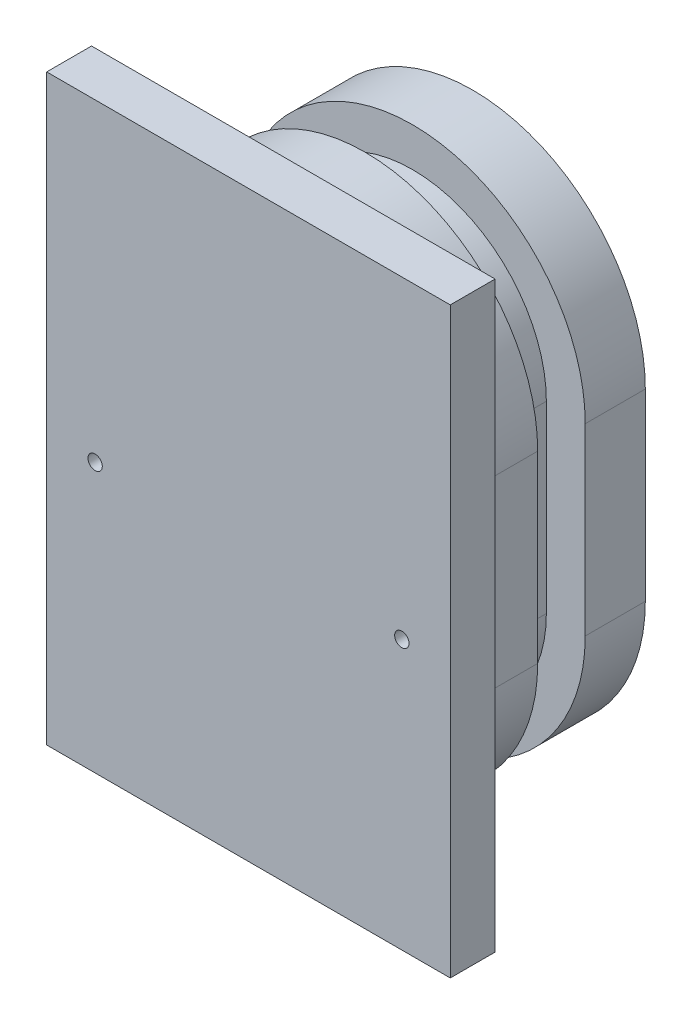
from build123d import *

# Parameters (mm, degrees)
SKETCH1_W                 = 45
SKETCH1_H                 = 65
BOSS_EXTRUDE1_DEPTH       = 5
BOSS_EXTRUDE2_DEPTH       = 20
BOSS_EXTRUDE3_DEPTH       = 5.3
M2X0_4_TAPPED_HOLE1_D     = 1.6
M2X0_4_TAPPED_HOLE1_DEPTH = 6
M2X0_4_TAPPED_HOLE1_TIP   = 0.480688495


with BuildPart() as part:
    # Sketch1 → Boss-Extrude1 (new body)
    with BuildSketch(Plane.XY):
        with Locations((2.886207951, -16.286739239)):
            Rectangle(SKETCH1_W, SKETCH1_H)
    extrude(amount=BOSS_EXTRUDE1_DEPTH)

    # Sketch4 → Boss-Extrude2 (add)
    with BuildSketch(Plane(origin=(0, 0, 0), x_dir=(-1, 0, 0), z_dir=(0, 0, -1))):
        with BuildLine():
            Line((16.363792049, -6.036739239), (16.363792049, -26.536739239))
            ThreePointArc((16.363792049, -26.536739239), (-2.886207951, -45.786739239), (-22.136207951, -26.536739239))
            Line((-22.136207951, -26.536739239), (-22.136207951, -6.036739239))
            ThreePointArc((-22.136207951, -6.036739239), (-2.886207951, 13.213260761), (16.363792049, -6.036739239))
        make_face()
        with BuildLine():
            Line((7.863792049, -6.036739239), (7.863792049, -26.536739239))
            ThreePointArc((7.863792049, -26.536739239), (-2.886207951, -37.286739239), (-13.636207951, -26.536739239))
            Line((-13.636207951, -26.536739239), (-13.636207951, -6.036739239))
            ThreePointArc((-13.636207951, -6.036739239), (-2.886207951, 4.713260761), (7.863792049, -6.036739239))
        make_face(mode=Mode.SUBTRACT)
    extrude(amount=BOSS_EXTRUDE2_DEPTH)


with BuildPart() as body_2:
    # Sketch6 → Boss-Extrude3 (new body)
    with BuildSketch(Plane(origin=(0, 0, 0), x_dir=(-1, 0, 0), z_dir=(0, 0, -1))):
        with BuildLine():
            Line((16.363792049, -6.036739239), (16.363792049, -26.536739239))
            ThreePointArc((16.363792049, -26.536739239), (-2.886207951, -45.786739239), (-22.136207951, -26.536739239))
            Line((-22.136207951, -26.536739239), (-22.136207951, -6.036739239))
            ThreePointArc((-22.136207951, -6.036739239), (-2.886207951, 13.213260761), (16.363792049, -6.036739239))
        make_face()
        with BuildLine():
            Line((12.029792049, -6.036739239), (12.029792049, -26.536739239))
            ThreePointArc((12.029792049, -26.536739239), (-2.886207951, -41.452739239), (-17.802207951, -26.536739239))
            Line((-17.802207951, -26.536739239), (-17.802207951, -6.036739239))
            ThreePointArc((-17.802207951, -6.036739239), (-2.886207951, 8.879260761), (12.029792049, -6.036739239))
        make_face(mode=Mode.SUBTRACT)
    extrude(amount=BOSS_EXTRUDE3_DEPTH)


with BuildPart() as body_2_1:
    # Body-Move/Copy1: read off the stored shape, not the designer's step
    # Body-Move/Copy1: moved
    add(body_2.part.moved(Location((0, 0, -8))))


with BuildPart() as part_1:
    add(part.part)

    # Combine1: cut body 2
    add(body_2_1.part, mode=Mode.SUBTRACT)

    # M2x0.4 Tapped Hole1
    with Locations(Plane.XY.offset(5)):
        with Locations((-14.213792049, -18.786739239), (19.986207951, -18.786739239)):
            Hole(M2X0_4_TAPPED_HOLE1_D / 2, depth=M2X0_4_TAPPED_HOLE1_DEPTH)
            with Locations((0, 0, -(M2X0_4_TAPPED_HOLE1_DEPTH + M2X0_4_TAPPED_HOLE1_TIP / 2))):  # 118° drill point
                Cone(0, M2X0_4_TAPPED_HOLE1_D / 2, M2X0_4_TAPPED_HOLE1_TIP, mode=Mode.SUBTRACT)


solid = part_1.part
